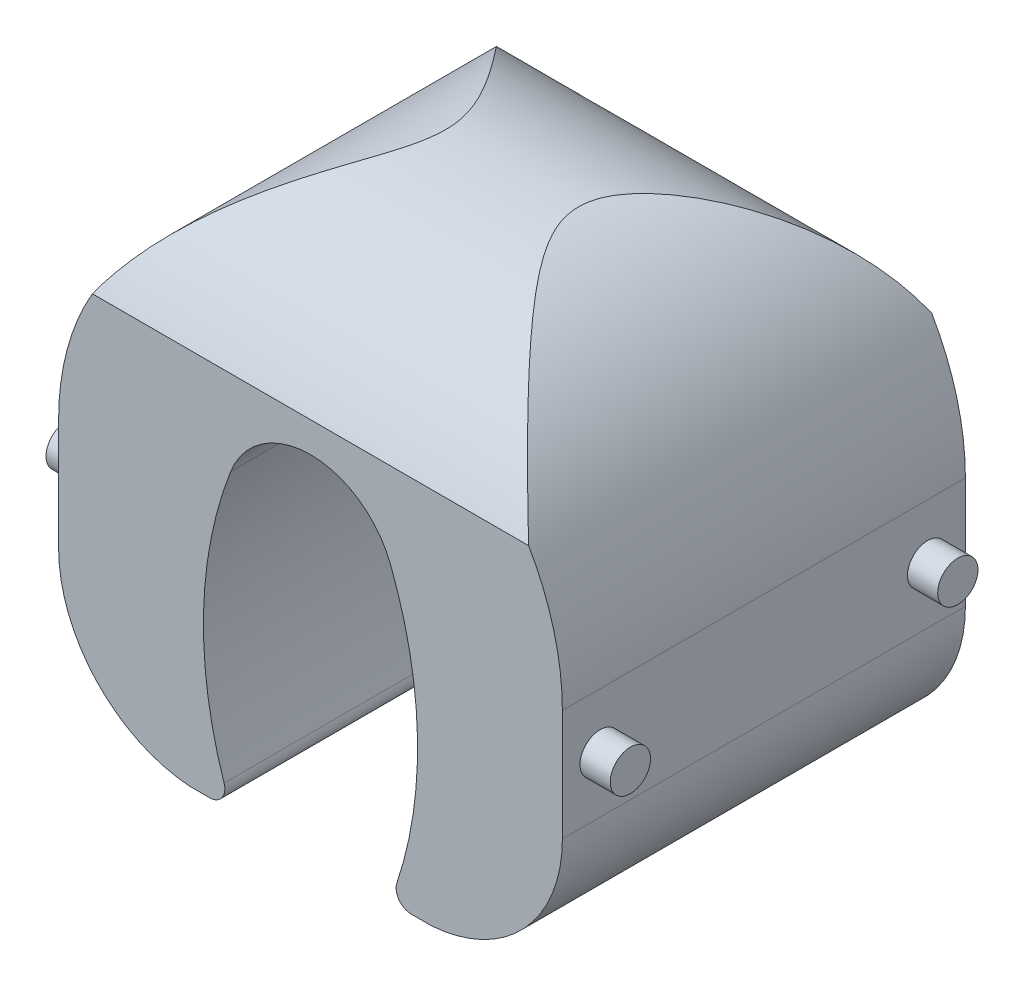
from build123d import *

# Parameters (mm, degrees)
SKETCH1_W                           = 50
SKETCH1_H                           = 50
BOSS_EXTRUDE1_DEPTH                 = 60
CUT_EXTRUDE1_DEPTH                  = 60
CUT_EXTRUDE2_START                  = -60
CUT_EXTRUDE2_DEPTH                  = 60
SKETCH5_OUTSIDE_W                   = 70.548
SKETCH5_OUTSIDE_H                   = 70.548
CUT_EXTRUDE3_DEPTH                  = 10
CUT_EXTRUDE4_DEPTH                  = 10
FILLET1_R                           = 1
SKETCH7_R                           = 2
BOSS_EXTRUDE2_DEPTH                 = 2
BOSS_EXTRUDE3_START                 = 2
SKETCH8_R                           = 2
BOSS_EXTRUDE3_DEPTH                 = 2
SKETCH9_R                           = 2.25
CUT_EXTRUDE5_DEPTH                  = 2
CUT_EXTRUDE6_START                  = -2
SKETCH10_R                          = 2.25
CUT_EXTRUDE6_DEPTH                  = 2
FILLET2_R                           = 1
CUT_EXTRUDE7_REACH                  = 71.642
CUT_EXTRUDE7_END_RADIUS             = 25
CUT_EXTRUDE7_DIRECTION_2_REACH      = 71.642
CUT_EXTRUDE7_DIRECTION_2_END_RADIUS = 25
SKETCH12_W                          = 10
SKETCH12_H                          = 10
CUT_EXTRUDE8_DEPTH                  = 29.758852585
SKETCH13_W                          = 10
SKETCH13_H                          = 14.003619208
CUT_EXTRUDE9_DEPTH                  = 31.758852585
SKETCH14_R                          = 2
BOSS_EXTRUDE4_DEPTH                 = 3
BOSS_EXTRUDE5_START                 = 3
SKETCH15_R                          = 2
BOSS_EXTRUDE5_DEPTH                 = 3


# Read off the part's stored shape, not the designer's step: Cut-Extrude2
with BuildPart() as part:
    # Sketch1 → Boss-Extrude1 (new body)
    with BuildSketch(Plane.XY):
        Rectangle(SKETCH1_W, SKETCH1_H)
    extrude(amount=BOSS_EXTRUDE1_DEPTH)

    # Sketch3 → Cut-Extrude1 (cut)
    with BuildSketch(Plane.XY.offset(60)):
        with BuildLine():
            Line((-25, 25), (-25, 0))
            ThreePointArc((-25, 0), (-17.677669541, 17.677669518), (-3.2e-08, 25))
            Line((-3.2e-08, 25), (-25, 25))
        make_face()
        with BuildLine():
            Line((25, 25), (-3.2e-08, 25))
            ThreePointArc((-3.2e-08, 25), (17.677669518, 17.677669541), (25, 0))
            Line((25, 0), (25, 25))
        make_face()
    extrude(amount=-CUT_EXTRUDE1_DEPTH, mode=Mode.SUBTRACT)

    # Cut-Extrude2 outline → Cut-Extrude2 (cut)
    with BuildSketch(Plane.XY.offset(60).offset(CUT_EXTRUDE2_START)):
        with BuildLine():
            ThreePointArc((8.576916353, -23.025834486), (10.616475204, -9.420494413), (7.92577262, 4.071177033))
            ThreePointArc((7.92577262, 4.071177033), (0, 9.5), (-7.92577262, 4.071177033))
            ThreePointArc((-7.92577262, 4.071177033), (-10.616475204, -9.420494413), (-8.576916353, -23.025834486))
            ThreePointArc((-8.576916353, -23.025834486), (-8.783191003, -24.377140732), (-10, -25))
            Line((-10, -25), (10, -25))
            ThreePointArc((10, -25), (8.783191003, -24.377140732), (8.576916353, -23.025834486))
        make_face()
        with BuildLine():
            ThreePointArc((25, -11.035759956), (21.246950766, -20.57515197), (12, -25))
            Line((12, -25), (25, -25))
            Line((25, -25), (25, -11.035759956))
        make_face()
        with BuildLine():
            Line((-25, -25), (-12, -25))
            ThreePointArc((-12, -25), (-21.246950766, -20.57515197), (-25, -11.035759956))
            Line((-25, -11.035759956), (-25, -25))
        make_face()
    extrude(amount=CUT_EXTRUDE2_DEPTH, mode=Mode.SUBTRACT)

    # Sketch5 outside → Cut-Extrude3 (cut)
    with BuildSketch(Plane.XY.offset(60)):
        Rectangle(SKETCH5_OUTSIDE_W, SKETCH5_OUTSIDE_H)
        with BuildLine():
            Line((-7.92577262, 4.071177033), (-12.879426293, 4.071177033))
            Line((-12.879426293, 4.071177033), (-12.879426293, -5.928822967))
            Line((-12.879426293, -5.928822967), (-10.379426293, -5.928822967))
            ThreePointArc((-10.379426293, -5.928822967), (-9.475712618, -0.849542187), (-7.92577262, 4.071177033))
        make_face(mode=Mode.SUBTRACT)
        with BuildLine():
            Line((7.92577262, 4.071177033), (12.879426293, 4.071177033))
            Line((12.879426293, 4.071177033), (12.879426293, -5.928822967))
            Line((12.879426293, -5.928822967), (10.379426293, -5.928822967))
            ThreePointArc((10.379426293, -5.928822967), (9.475712618, -0.849542187), (7.92577262, 4.071177033))
        make_face(mode=Mode.SUBTRACT)
    extrude(amount=-CUT_EXTRUDE3_DEPTH, mode=Mode.SUBTRACT)

    # Sketch6 → Cut-Extrude4 (cut)
    # profile 1 of 4: a face of its own
    with BuildSketch(Plane(origin=(0, 0, 0), x_dir=(-1, 0, 0), z_dir=(0, 0, -1))):
        with BuildLine():
            Line((0, 9.5), (0, 25))
            ThreePointArc((0, 25), (-17.67766953, 17.67766953), (-25, 0))
            Line((-25, 0), (-25, -11.035759956))
            ThreePointArc((-25, -11.035759956), (-21.246950766, -20.57515197), (-12, -25))
            Line((-12, -25), (-10, -25))
            ThreePointArc((-10, -25), (-8.783191003, -24.377140732), (-8.576916353, -23.025834486))
            ThreePointArc((-8.576916353, -23.025834486), (-10.289550459, -15.574005024), (-10.552980025, -7.932442175))
            ThreePointArc((-10.552980025, -7.932442175), (-10.478797406, -6.929541656), (-10.379426293, -5.928822967))
            ThreePointArc((-10.379426293, -5.928822967), (-9.475712618, -0.849542187), (-7.92577262, 4.071177033))
            ThreePointArc((-7.92577262, 4.071177033), (-4.803383975, 8.012667281), (0, 9.5))
        make_face()
        with BuildLine():
            Line((-12.879426293, 6.071177033), (-12.879426293, 3.071177033))
            Line((-12.879426293, 3.071177033), (-12.879426293, -4.928822967))
            Line((-12.879426293, -4.928822967), (-12.879426293, -7.932442175))
            Line((-12.879426293, -7.932442175), (-14.879423018, -7.932442175))
            ThreePointArc((-14.879423018, -7.932442175), (-15.586532115, -7.639547997), (-15.879426293, -6.932438901))
            Line((-15.879426293, -6.932438901), (-15.879426293, 5.071173759))
            ThreePointArc((-15.879426293, 5.071173759), (-15.586532115, 5.778282855), (-14.879423018, 6.071177033))
            Line((-14.879423018, 6.071177033), (-12.879426293, 6.071177033))
        make_face(mode=Mode.SUBTRACT)
    # profile 2 of 4: a face of its own
    with BuildSketch(Plane(origin=(0, 0, 0), x_dir=(-1, 0, 0), z_dir=(0, 0, -1))):
        with BuildLine():
            ThreePointArc((25, 0), (17.67766953, 17.67766953), (0, 25))
            Line((0, 25), (0, 9.5))
            ThreePointArc((0, 9.5), (4.803383975, 8.012667281), (7.92577262, 4.071177033))
            ThreePointArc((7.92577262, 4.071177033), (10.616475204, -9.420494413), (8.576916353, -23.025834486))
            ThreePointArc((8.576916353, -23.025834486), (8.783191003, -24.377140732), (10, -25))
            Line((10, -25), (12, -25))
            ThreePointArc((12, -25), (21.246950766, -20.57515197), (25, -11.035759956))
            Line((25, -11.035759956), (25, 0))
        make_face()
        with BuildLine():
            Line((12.879426293, -4.928822967), (12.879426293, 3.071177033))
            Line((12.879426293, 3.071177033), (12.879426293, 6.071177033))
            Line((12.879426293, 6.071177033), (14.879423018, 6.071177033))
            ThreePointArc((14.879423018, 6.071177033), (15.586532115, 5.778282855), (15.879426293, 5.071173759))
            Line((15.879426293, 5.071173759), (15.879426293, -6.932438901))
            ThreePointArc((15.879426293, -6.932438901), (15.586532115, -7.639547997), (14.879423018, -7.932442175))
            Line((14.879423018, -7.932442175), (12.879426293, -7.932442175))
            Line((12.879426293, -7.932442175), (12.879426293, -4.928822967))
        make_face(mode=Mode.SUBTRACT)
    # profile 3 of 4: a face of its own
    with BuildSketch(Plane(origin=(0, 0, 0), x_dir=(-1, 0, 0), z_dir=(0, 0, -1))):
        with BuildLine():
            Line((0, 9.5), (0, 25))
            ThreePointArc((0, 25), (-17.67766953, 17.67766953), (-25, 0))
            Line((-25, 0), (-25, -11.035759956))
            ThreePointArc((-25, -11.035759956), (-21.246950766, -20.57515197), (-12, -25))
            Line((-12, -25), (-10, -25))
            ThreePointArc((-10, -25), (-8.783191003, -24.377140732), (-8.576916353, -23.025834486))
            ThreePointArc((-8.576916353, -23.025834486), (-10.289550459, -15.574005024), (-10.552980025, -7.932442175))
            ThreePointArc((-10.552980025, -7.932442175), (-10.478797406, -6.929541656), (-10.379426293, -5.928822967))
            ThreePointArc((-10.379426293, -5.928822967), (-9.475712618, -0.849542187), (-7.92577262, 4.071177033))
            ThreePointArc((-7.92577262, 4.071177033), (-4.803383975, 8.012667281), (0, 9.5))
        make_face()
        with BuildLine():
            Line((-12.879426293, 6.071177033), (-12.879426293, 3.071177033))
            Line((-12.879426293, 3.071177033), (-12.879426293, -4.928822967))
            Line((-12.879426293, -4.928822967), (-12.879426293, -7.932442175))
            Line((-12.879426293, -7.932442175), (-14.879423018, -7.932442175))
            ThreePointArc((-14.879423018, -7.932442175), (-15.586532115, -7.639547997), (-15.879426293, -6.932438901))
            Line((-15.879426293, -6.932438901), (-15.879426293, 5.071173759))
            ThreePointArc((-15.879426293, 5.071173759), (-15.586532115, 5.778282855), (-14.879423018, 6.071177033))
            Line((-14.879423018, 6.071177033), (-12.879426293, 6.071177033))
        make_face(mode=Mode.SUBTRACT)
    # profile 4 of 4: a face of its own
    with BuildSketch(Plane(origin=(0, 0, 0), x_dir=(-1, 0, 0), z_dir=(0, 0, -1))):
        with BuildLine():
            ThreePointArc((25, 0), (17.67766953, 17.67766953), (0, 25))
            Line((0, 25), (0, 9.5))
            ThreePointArc((0, 9.5), (4.803383975, 8.012667281), (7.92577262, 4.071177033))
            ThreePointArc((7.92577262, 4.071177033), (10.616475204, -9.420494413), (8.576916353, -23.025834486))
            ThreePointArc((8.576916353, -23.025834486), (8.783191003, -24.377140732), (10, -25))
            Line((10, -25), (12, -25))
            ThreePointArc((12, -25), (21.246950766, -20.57515197), (25, -11.035759956))
            Line((25, -11.035759956), (25, 0))
        make_face()
        with BuildLine():
            Line((12.879426293, -4.928822967), (12.879426293, 3.071177033))
            Line((12.879426293, 3.071177033), (12.879426293, 6.071177033))
            Line((12.879426293, 6.071177033), (14.879423018, 6.071177033))
            ThreePointArc((14.879423018, 6.071177033), (15.586532115, 5.778282855), (15.879426293, 5.071173759))
            Line((15.879426293, 5.071173759), (15.879426293, -6.932438901))
            ThreePointArc((15.879426293, -6.932438901), (15.586532115, -7.639547997), (14.879423018, -7.932442175))
            Line((14.879423018, -7.932442175), (12.879426293, -7.932442175))
            Line((12.879426293, -7.932442175), (12.879426293, -4.928822967))
        make_face(mode=Mode.SUBTRACT)
    extrude(amount=-CUT_EXTRUDE4_DEPTH, mode=Mode.SUBTRACT)

    # Fillet1
    fillet1_edges = [part.edges().sort_by_distance(p)[0] for p in [
        (12.879426293, 4.071177033, 55),
        (12.879426293, -5.928822967, 55),
        (-12.879426293, -5.928822967, 55),
        (-12.879426293, 4.071177033, 55),
    ]]
    fillet(fillet1_edges, radius=FILLET1_R)

    # Sketch7 → Boss-Extrude2 (add)
    with BuildSketch(Plane.ZY.offset(12.879426293)):
        with Locations(Location((55, -0.928822967, 0), (0, 0, 270))):
            Circle(SKETCH7_R)
    extrude(amount=BOSS_EXTRUDE2_DEPTH)

    # Sketch8 → Boss-Extrude3 (add)
    with BuildSketch(Plane(origin=(12.879426293, 0, 0), x_dir=(0, 0, -1), z_dir=(1, 0, 0)).offset(BOSS_EXTRUDE3_START)):
        with Locations(Location((-55, -0.928822967, 0), (0, 0, 270))):
            Circle(SKETCH8_R)
    extrude(amount=-BOSS_EXTRUDE3_DEPTH)

    # Sketch9 → Cut-Extrude5 (cut)
    with BuildSketch(Plane.ZY.offset(-12.879426293)):
        with Locations(Location((5, -0.930632571, 0), (0, 0, 270))):
            Circle(SKETCH9_R)
    extrude(amount=-CUT_EXTRUDE5_DEPTH, mode=Mode.SUBTRACT)

    # Sketch10 → Cut-Extrude6 (cut)
    with BuildSketch(Plane(origin=(-12.879426293, 0, 0), x_dir=(0, 0, -1), z_dir=(1, 0, 0)).offset(CUT_EXTRUDE6_START)):
        with Locations(Location((-5, -0.930632571, 0), (0, 0, 270))):
            Circle(SKETCH10_R)
    extrude(amount=CUT_EXTRUDE6_DEPTH, mode=Mode.SUBTRACT)

    # Fillet2
    fillet2_edges = [part.edges().sort_by_distance(p)[0] for p in [
        (-12.879426293, 6.071177033, 5),
        (-12.879426293, -7.932442175, 5),
        (12.879426293, -7.932442175, 5),
        (12.879426293, 6.071177033, 5),
    ]]
    fillet(fillet2_edges, radius=FILLET2_R)

    # Cut-Extrude7: up to this cylinder (the profile starts inside it)
    cut_extrude7_end = Plane(origin=(0, 0, 27.7442175), z_dir=(0, 0, 1)) * Cylinder(CUT_EXTRUDE7_END_RADIUS, 227.198087, mode=Mode.PRIVATE)
    # Sketch11 → Cut-Extrude7 (cut, up to the surface)
    with BuildSketch(Plane(origin=(0, 0, 0), x_dir=(0, 0, -1), z_dir=(1, 0, 0)), mode=Mode.PRIVATE) as cut_extrude7_sk1:
        with BuildLine():
            add(Edge.make_bspline(
                [(-50, 12.5), (-45.835040113, 20.240050977), (-37.917520056, 24.110076465), (-30, 24.110076465)],
                knots=[0, 0, 0, 0, 0.5, 0.5, 0.5, 0.5], degree=3))
            Line((-30, 24.110076465), (-30, 25))
            Line((-30, 25), (-50, 25))
            Line((-50, 25), (-50, 12.5))
        make_face()
    cut_extrude7_tool1 = extrude(cut_extrude7_sk1.sketch, amount=CUT_EXTRUDE7_REACH, mode=Mode.PRIVATE) & cut_extrude7_end
    add(cut_extrude7_tool1.solids().sort_by_distance((0, 21.671006, 44.201261))[0], mode=Mode.SUBTRACT)
    # Sketch11 → Cut-Extrude7 (cut, up to the surface)
    with BuildSketch(Plane(origin=(0, 0, 0), x_dir=(0, 0, -1), z_dir=(1, 0, 0)), mode=Mode.PRIVATE) as cut_extrude7_sk2:
        with BuildLine():
            add(Edge.make_bspline(
                [(-30, 24.110076465), (-22.082479944, 24.110076465), (-14.164959887, 20.240050977), (-10, 12.5)],
                knots=[0.5, 0.5, 0.5, 0.5, 1, 1, 1, 1], degree=3))
            ThreePointArc((-10, 12.5), (-11.128726859, 19.123824427), (-14.387505004, 25))
            Line((-14.387505004, 25), (-30, 25))
            Line((-30, 25), (-30, 24.110076465))
        make_face()
    cut_extrude7_tool2 = extrude(cut_extrude7_sk2.sketch, amount=CUT_EXTRUDE7_REACH, mode=Mode.PRIVATE) & cut_extrude7_end
    add(cut_extrude7_tool2.solids().sort_by_distance((0, 21.59828, 16.984521))[0], mode=Mode.SUBTRACT)
    # Sketch11 → Cut-Extrude7 (cut, up to the surface)
    with BuildSketch(Plane(origin=(0, 0, 0), x_dir=(0, 0, -1), z_dir=(1, 0, 0)), mode=Mode.PRIVATE) as cut_extrude7_sk3:
        with BuildLine():
            ThreePointArc((-14.387505004, 25), (-11.128726859, 19.123824427), (-10, 12.5))
            Line((-10, 12.5), (-10, 25))
            Line((-10, 25), (-14.387505004, 25))
        make_face()
    cut_extrude7_tool3 = extrude(cut_extrude7_sk3.sketch, amount=CUT_EXTRUDE7_REACH, mode=Mode.PRIVATE) & cut_extrude7_end
    add(cut_extrude7_tool3.solids().sort_by_distance((0, 21.947708, 11.287174))[0], mode=Mode.SUBTRACT)

    # Cut-Extrude7 direction 2: up to this cylinder (the profile starts inside it)
    cut_extrude7_direction_2_end = Plane(origin=(0, 0, 27.7442175), z_dir=(0, 0, 1)) * Cylinder(CUT_EXTRUDE7_DIRECTION_2_END_RADIUS, 227.198087, mode=Mode.PRIVATE)
    # Sketch11 → Cut-Extrude7 direction 2 (cut, up to the surface)
    with BuildSketch(Plane(origin=(0, 0, 0), x_dir=(0, 0, -1), z_dir=(1, 0, 0)), mode=Mode.PRIVATE) as cut_extrude7_direction_2_sk1:
        with BuildLine():
            add(Edge.make_bspline(
                [(-50, 12.5), (-45.835040113, 20.240050977), (-37.917520056, 24.110076465), (-30, 24.110076465)],
                knots=[0, 0, 0, 0, 0.5, 0.5, 0.5, 0.5], degree=3))
            Line((-30, 24.110076465), (-30, 25))
            Line((-30, 25), (-50, 25))
            Line((-50, 25), (-50, 12.5))
        make_face()
    cut_extrude7_direction_2_tool1 = extrude(cut_extrude7_direction_2_sk1.sketch, amount=-CUT_EXTRUDE7_DIRECTION_2_REACH, mode=Mode.PRIVATE) & cut_extrude7_direction_2_end
    add(cut_extrude7_direction_2_tool1.solids().sort_by_distance((0, 21.671006, 44.201261))[0], mode=Mode.SUBTRACT)
    # Sketch11 → Cut-Extrude7 direction 2 (cut, up to the surface)
    with BuildSketch(Plane(origin=(0, 0, 0), x_dir=(0, 0, -1), z_dir=(1, 0, 0)), mode=Mode.PRIVATE) as cut_extrude7_direction_2_sk2:
        with BuildLine():
            add(Edge.make_bspline(
                [(-30, 24.110076465), (-22.082479944, 24.110076465), (-14.164959887, 20.240050977), (-10, 12.5)],
                knots=[0.5, 0.5, 0.5, 0.5, 1, 1, 1, 1], degree=3))
            ThreePointArc((-10, 12.5), (-11.128726859, 19.123824427), (-14.387505004, 25))
            Line((-14.387505004, 25), (-30, 25))
            Line((-30, 25), (-30, 24.110076465))
        make_face()
    cut_extrude7_direction_2_tool2 = extrude(cut_extrude7_direction_2_sk2.sketch, amount=-CUT_EXTRUDE7_DIRECTION_2_REACH, mode=Mode.PRIVATE) & cut_extrude7_direction_2_end
    add(cut_extrude7_direction_2_tool2.solids().sort_by_distance((0, 21.59828, 16.984521))[0], mode=Mode.SUBTRACT)
    # Sketch11 → Cut-Extrude7 direction 2 (cut, up to the surface)
    with BuildSketch(Plane(origin=(0, 0, 0), x_dir=(0, 0, -1), z_dir=(1, 0, 0)), mode=Mode.PRIVATE) as cut_extrude7_direction_2_sk3:
        with BuildLine():
            ThreePointArc((-14.387505004, 25), (-11.128726859, 19.123824427), (-10, 12.5))
            Line((-10, 12.5), (-10, 25))
            Line((-10, 25), (-14.387505004, 25))
        make_face()
    cut_extrude7_direction_2_tool3 = extrude(cut_extrude7_direction_2_sk3.sketch, amount=-CUT_EXTRUDE7_DIRECTION_2_REACH, mode=Mode.PRIVATE) & cut_extrude7_direction_2_end
    add(cut_extrude7_direction_2_tool3.solids().sort_by_distance((0, 21.947708, 11.287174))[0], mode=Mode.SUBTRACT)

    # Sketch12 → Cut-Extrude8 (cut)
    with BuildSketch(Plane(origin=(14.879426293, 0, 0), x_dir=(0, 0, -1), z_dir=(1, 0, 0))):
        with Locations((-55, -0.928822967)):
            Rectangle(SKETCH12_W, SKETCH12_H)
    extrude(amount=-CUT_EXTRUDE8_DEPTH, mode=Mode.SUBTRACT)

    # Sketch13 → Cut-Extrude9 (cut)
    with BuildSketch(Plane(origin=(15.879426293, 0, 0), x_dir=(0, 0, -1), z_dir=(1, 0, 0))):
        with Locations((-5, -0.930632571)):
            Rectangle(SKETCH13_W, SKETCH13_H)
    extrude(amount=-CUT_EXTRUDE9_DEPTH, mode=Mode.SUBTRACT)

    # Sketch14 → Boss-Extrude4 (add)
    with BuildSketch(Plane(origin=(25, 0, 0), x_dir=(0, 0, -1), z_dir=(1, 0, 0))):
        with Locations(Location((-13.75, -5.517879978, 0), (0, 0, 180))):
            Circle(SKETCH14_R)
        with Locations(Location((-46.25, -5.517879978, 0), (0, 0, 180))):
            Circle(SKETCH14_R)
    extrude(amount=BOSS_EXTRUDE4_DEPTH)

    # Sketch15 → Boss-Extrude5 (add)
    with BuildSketch(Plane.ZY.offset(25).offset(BOSS_EXTRUDE5_START)):
        with Locations((13.75, -5.517879978)):
            Circle(SKETCH15_R)
        with Locations((46.25, -5.517879978)):
            Circle(SKETCH15_R)
    extrude(amount=-BOSS_EXTRUDE5_DEPTH)


solid = part.part
